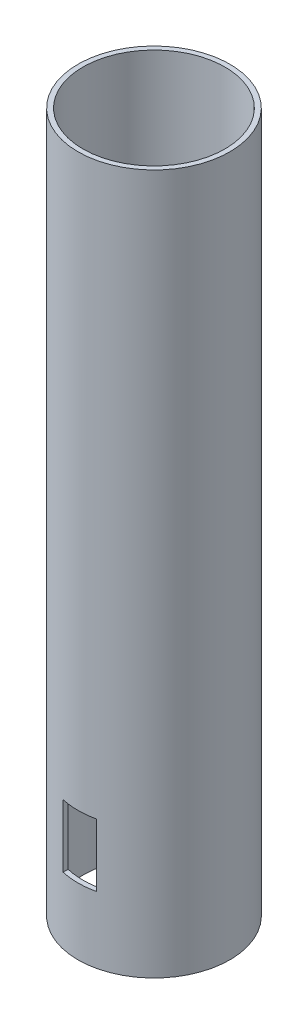
from build123d import *

# Parameters (mm, degrees)
SKETCH1_R               = 27.125
SKETCH1_R_2             = 25.375
BOSS_EXTRUDE1_DEPTH     = 125
CUT_EXTRUDE1_DEPTH      = 131.753704536
CUT_EXTRUDE1_DEPTH_BACK = 131.753704536
SKETCH5_W               = 12
SKETCH5_H               = 22.45


with BuildPart() as part:
    # Sketch1 → Boss-Extrude1 (new, symmetric)
    with BuildSketch(Plane(origin=(0, 0, 0), x_dir=(1, 0, 0), z_dir=(0, 1, 0))):
        Circle(SKETCH1_R)
        Circle(SKETCH1_R_2, mode=Mode.SUBTRACT)
    extrude(amount=BOSS_EXTRUDE1_DEPTH, both=True)

    # Sketch5 → Cut-Extrude1 (cut, two sides: drawn at the far end of the back side and taken through both)
    with BuildSketch(Plane.XY.offset(-CUT_EXTRUDE1_DEPTH_BACK)):
        with Locations((0, -89.975)):
            Rectangle(SKETCH5_W, SKETCH5_H)
    extrude(amount=CUT_EXTRUDE1_DEPTH + CUT_EXTRUDE1_DEPTH_BACK, mode=Mode.SUBTRACT)


solid = part.part
